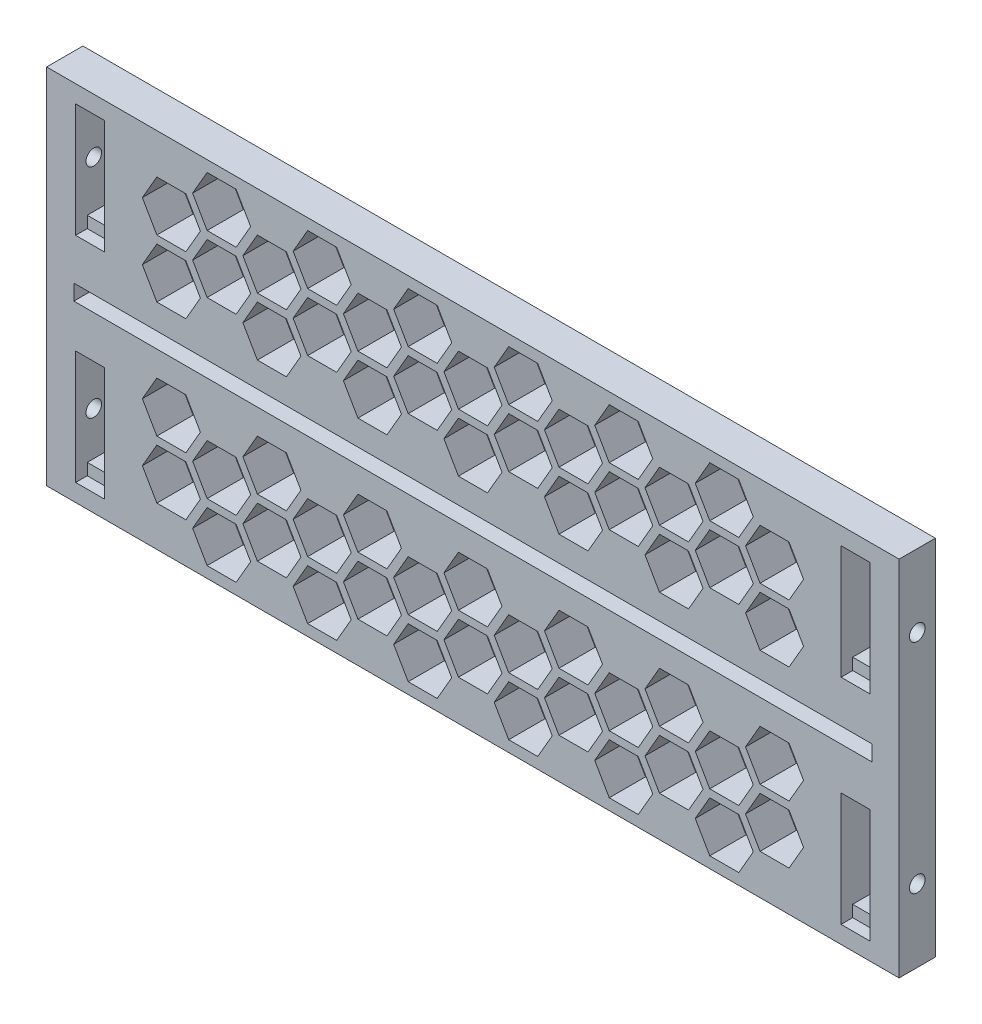
from build123d import *

# Parameters (mm, degrees)
SKETCH1_W                                  = 235
SKETCH1_H                                  = 100
BOSS_EXTRUDE1_DEPTH                        = 10
CUT_EXTRUDE1_REACH                         = 130.087
SKETCH3_W                                  = 8
SKETCH3_H                                  = 25
SKETCH4_R                                  = 2.15
CUT_EXTRUDE2_DEPTH                         = 8
SKETCH5_W                                  = 220
SKETCH5_H                                  = 4.3
CUT_EXTRUDE3_DEPTH                         = 10
FILL_PATTERN1_DEPTH                        = 10
SKETCH7_W                                  = 8
SKETCH7_H                                  = 3.2
CUT_EXTRUDE4_DEPTH                         = 3.2
MIRROR4_AT_THE_SECOND_PLANE_COPY_1_REACH   = 130.087
MIRROR4_AT_THE_SECOND_PLANE_COPY_1_SKETC_W = 8
MIRROR4_AT_THE_SECOND_PLANE_COPY_1_SKETC_H = 25
MIRROR4_AT_THE_SECOND_PLANE_COPY_2_SKETC_W = 8
MIRROR4_AT_THE_SECOND_PLANE_COPY_2_SKETC_H = 3.2
MIRROR4_AT_THE_SECOND_PLANE_COPY_2_DEPTH   = 3.2


# Read off the part's stored shape, not the designer's step: Fill Pattern1
with BuildPart() as part:
    # Sketch1 → Boss-Extrude1 (new body)
    with BuildSketch(Plane.XY):
        Rectangle(SKETCH1_W, SKETCH1_H)
    extrude(amount=BOSS_EXTRUDE1_DEPTH)

    # Sketch3 → Cut-Extrude1 (cut, up to next)
    with BuildSketch(Plane.XY.offset(10), mode=Mode.PRIVATE) as cut_extrude1_sk1:
        with Locations((-105.5, 29.5)):
            Rectangle(SKETCH3_W, SKETCH3_H)
    cut_extrude1_tool1 = extrude(cut_extrude1_sk1.sketch, amount=-CUT_EXTRUDE1_REACH, mode=Mode.PRIVATE) & part.part
    cut_extrude1 = cut_extrude1_tool1.solids().sort_by_distance((-105.5, 29.5, 10))[0]
    add(cut_extrude1, mode=Mode.SUBTRACT)

    # Sketch4 → Cut-Extrude2 (cut)
    with BuildSketch(Plane.ZY.offset(117.5)):
        with Locations(Location((5, -30, 0), (0, 0, 270))):
            Circle(SKETCH4_R)
        with Locations(Location((5, 30, 0), (0, 0, 270))):
            Circle(SKETCH4_R)
    cut_extrude2 = extrude(amount=-CUT_EXTRUDE2_DEPTH, mode=Mode.SUBTRACT)

    # Mirror1: Cut-Extrude2 across plane
    add(cut_extrude2.mirror(Plane.ZY), mode=Mode.SUBTRACT)

    # Sketch5 → Cut-Extrude3 (cut)
    with BuildSketch(Plane.XY.offset(10)):
        Rectangle(SKETCH5_W, SKETCH5_H)
    extrude(amount=-CUT_EXTRUDE3_DEPTH, mode=Mode.SUBTRACT)

    # Fill Pattern1 outline → Fill Pattern1 (cut)
    with BuildSketch(Plane.XY):
        Polygon((77.306824734, -40), (73.306824734, -33.07179677), (65.306824734, -33.07179677), (61.306824734, -40), (65.306824734, -46.92820323), (73.306824734, -46.92820323), align=None)
        Polygon((35.737605353, 32), (31.737605353, 38.92820323), (23.737605353, 38.92820323), (19.737605353, 32), (23.737605353, 25.07179677), (31.737605353, 25.07179677), align=None)
        Polygon((63.450418274, -16), (59.450418274, -9.07179677), (51.450418274, -9.07179677), (47.450418274, -16), (51.450418274, -22.92820323), (59.450418274, -22.92820323), align=None)
        Polygon((45.594011813, -33.07179677), (37.594011813, -33.07179677), (33.594011813, -40), (37.594011813, -46.92820323), (45.594011813, -46.92820323), (49.594011813, -40), align=None)
        Polygon((17.881198892, -33.07179677), (9.881198892, -33.07179677), (5.881198892, -40), (9.881198892, -46.92820323), (17.881198892, -46.92820323), (21.881198892, -40), align=None)
        Polygon((-9.831614029, -33.07179677), (-17.831614029, -33.07179677), (-21.831614029, -40), (-17.831614029, -46.92820323), (-9.831614029, -46.92820323), (-5.831614029, -40), align=None)
        Polygon((-37.54442695, -33.07179677), (-45.54442695, -33.07179677), (-49.54442695, -40), (-45.54442695, -46.92820323), (-37.54442695, -46.92820323), (-33.54442695, -40), align=None)
        Polygon((-65.257239871, -33.07179677), (-73.257239871, -33.07179677), (-77.257239871, -40), (-73.257239871, -46.92820323), (-65.257239871, -46.92820323), (-61.257239871, -40), align=None)
        Polygon((79.163231195, -9.07179677), (75.163231195, -16), (79.163231195, -22.92820323), (87.163231195, -22.92820323), (91.163231195, -16), (87.163231195, -9.07179677), align=None)
        Polygon((21.881198892, 40), (17.881198892, 46.92820323), (9.881198892, 46.92820323), (5.881198892, 40), (9.881198892, 33.07179677), (17.881198892, 33.07179677), align=None)
        Polygon((35.737605353, 16), (31.737605353, 22.92820323), (23.737605353, 22.92820323), (19.737605353, 16), (23.737605353, 9.07179677), (31.737605353, 9.07179677), align=None)
        Polygon((63.450418274, -32), (59.450418274, -25.07179677), (51.450418274, -25.07179677), (47.450418274, -32), (51.450418274, -38.92820323), (59.450418274, -38.92820323), align=None)
        Polygon((-37.54442695, 46.92820323), (-45.54442695, 46.92820323), (-49.54442695, 40), (-45.54442695, 33.07179677), (-37.54442695, 33.07179677), (-33.54442695, 40), align=None)
        Polygon((-9.831614029, 46.92820323), (-17.831614029, 46.92820323), (-21.831614029, 40), (-17.831614029, 33.07179677), (-9.831614029, 33.07179677), (-5.831614029, 40), align=None)
        Polygon((73.306824734, 46.92820323), (65.306824734, 46.92820323), (61.306824734, 40), (65.306824734, 33.07179677), (73.306824734, 33.07179677), (77.306824734, 40), align=None)
        Polygon((45.594011813, 46.92820323), (37.594011813, 46.92820323), (33.594011813, 40), (37.594011813, 33.07179677), (45.594011813, 33.07179677), (49.594011813, 40), align=None)
        Polygon((-65.257239871, 46.92820323), (-73.257239871, 46.92820323), (-77.257239871, 40), (-73.257239871, 33.07179677), (-65.257239871, 33.07179677), (-61.257239871, 40), align=None)
        Polygon((-3.975207568, 22.92820323), (-7.975207568, 16), (-3.975207568, 9.07179677), (4.024792432, 9.07179677), (8.024792432, 16), (4.024792432, 22.92820323), align=None)
        Polygon((-31.688020489, -25.07179677), (-35.688020489, -32), (-31.688020489, -38.92820323), (-23.688020489, -38.92820323), (-19.688020489, -32), (-23.688020489, -25.07179677), align=None)
        Polygon((21.881198892, 24), (17.881198892, 30.92820323), (9.881198892, 30.92820323), (5.881198892, 24), (9.881198892, 17.07179677), (17.881198892, 17.07179677), align=None)
        Polygon((49.594011813, -24), (45.594011813, -17.07179677), (37.594011813, -17.07179677), (33.594011813, -24), (37.594011813, -30.92820323), (45.594011813, -30.92820323), align=None)
        Polygon((45.594011813, 30.92820323), (37.594011813, 30.92820323), (33.594011813, 24), (37.594011813, 17.07179677), (45.594011813, 17.07179677), (49.594011813, 24), align=None)
        Polygon((73.306824734, 30.92820323), (65.306824734, 30.92820323), (61.306824734, 24), (65.306824734, 17.07179677), (73.306824734, 17.07179677), (77.306824734, 24), align=None)
        Polygon((-9.831614029, 30.92820323), (-17.831614029, 30.92820323), (-21.831614029, 24), (-17.831614029, 17.07179677), (-9.831614029, 17.07179677), (-5.831614029, 24), align=None)
        Polygon((-65.257239871, 30.92820323), (-73.257239871, 30.92820323), (-77.257239871, 24), (-73.257239871, 17.07179677), (-65.257239871, 17.07179677), (-61.257239871, 24), align=None)
        Polygon((-37.54442695, 30.92820323), (-45.54442695, 30.92820323), (-49.54442695, 24), (-45.54442695, 17.07179677), (-37.54442695, 17.07179677), (-33.54442695, 24), align=None)
        Polygon((-17.831614029, -17.07179677), (-21.831614029, -24), (-17.831614029, -30.92820323), (-9.831614029, -30.92820323), (-5.831614029, -24), (-9.831614029, -17.07179677), align=None)
        Polygon((59.450418274, 22.92820323), (51.450418274, 22.92820323), (47.450418274, 16), (51.450418274, 9.07179677), (59.450418274, 9.07179677), (63.450418274, 16), align=None)
        Polygon((87.163231195, 22.92820323), (79.163231195, 22.92820323), (75.163231195, 16), (79.163231195, 9.07179677), (87.163231195, 9.07179677), (91.163231195, 16), align=None)
        Polygon((-79.113646332, 22.92820323), (-87.113646332, 22.92820323), (-91.113646332, 16), (-87.113646332, 9.07179677), (-79.113646332, 9.07179677), (-75.113646332, 16), align=None)
        Polygon((-51.40083341, 22.92820323), (-59.40083341, 22.92820323), (-63.40083341, 16), (-59.40083341, 9.07179677), (-51.40083341, 9.07179677), (-47.40083341, 16), align=None)
        Polygon((-23.688020489, 22.92820323), (-31.688020489, 22.92820323), (-35.688020489, 16), (-31.688020489, 9.07179677), (-23.688020489, 9.07179677), (-19.688020489, 16), align=None)
        Polygon((-3.975207568, -25.07179677), (-7.975207568, -32), (-3.975207568, -38.92820323), (4.024792432, -38.92820323), (8.024792432, -32), (4.024792432, -25.07179677), align=None)
        Polygon((91.163231195, -32), (87.163231195, -25.07179677), (79.163231195, -25.07179677), (75.163231195, -32), (79.163231195, -38.92820323), (87.163231195, -38.92820323), align=None)
        Polygon((23.737605353, -25.07179677), (19.737605353, -32), (23.737605353, -38.92820323), (31.737605353, -38.92820323), (35.737605353, -32), (31.737605353, -25.07179677), align=None)
        Polygon((91.163231195, 32), (87.163231195, 38.92820323), (79.163231195, 38.92820323), (75.163231195, 32), (79.163231195, 25.07179677), (87.163231195, 25.07179677), align=None)
        Polygon((4.024792432, 38.92820323), (-3.975207568, 38.92820323), (-7.975207568, 32), (-3.975207568, 25.07179677), (4.024792432, 25.07179677), (8.024792432, 32), align=None)
        Polygon((59.450418274, 38.92820323), (51.450418274, 38.92820323), (47.450418274, 32), (51.450418274, 25.07179677), (59.450418274, 25.07179677), (63.450418274, 32), align=None)
        Polygon((-79.113646332, 38.92820323), (-87.113646332, 38.92820323), (-91.113646332, 32), (-87.113646332, 25.07179677), (-79.113646332, 25.07179677), (-75.113646332, 32), align=None)
        Polygon((-23.688020489, 38.92820323), (-31.688020489, 38.92820323), (-35.688020489, 32), (-31.688020489, 25.07179677), (-23.688020489, 25.07179677), (-19.688020489, 32), align=None)
        Polygon((-51.40083341, 38.92820323), (-59.40083341, 38.92820323), (-63.40083341, 32), (-59.40083341, 25.07179677), (-51.40083341, 25.07179677), (-47.40083341, 32), align=None)
        Polygon((-3.975207568, -9.07179677), (-7.975207568, -16), (-3.975207568, -22.92820323), (4.024792432, -22.92820323), (8.024792432, -16), (4.024792432, -9.07179677), align=None)
        Polygon((77.306824734, -24), (73.306824734, -17.07179677), (65.306824734, -17.07179677), (61.306824734, -24), (65.306824734, -30.92820323), (73.306824734, -30.92820323), align=None)
        Polygon((9.881198892, -17.07179677), (5.881198892, -24), (9.881198892, -30.92820323), (17.881198892, -30.92820323), (21.881198892, -24), (17.881198892, -17.07179677), align=None)
        Polygon((-19.688020489, -16), (-23.688020489, -9.07179677), (-31.688020489, -9.07179677), (-35.688020489, -16), (-31.688020489, -22.92820323), (-23.688020489, -22.92820323), align=None)
        Polygon((31.737605353, -9.07179677), (23.737605353, -9.07179677), (19.737605353, -16), (23.737605353, -22.92820323), (31.737605353, -22.92820323), (35.737605353, -16), align=None)
        Polygon((-79.113646332, -9.07179677), (-87.113646332, -9.07179677), (-91.113646332, -16), (-87.113646332, -22.92820323), (-79.113646332, -22.92820323), (-75.113646332, -16), align=None)
        Polygon((-51.40083341, -9.07179677), (-59.40083341, -9.07179677), (-63.40083341, -16), (-59.40083341, -22.92820323), (-51.40083341, -22.92820323), (-47.40083341, -16), align=None)
        Polygon((-87.113646332, -25.07179677), (-91.113646332, -32), (-87.113646332, -38.92820323), (-79.113646332, -38.92820323), (-75.113646332, -32), (-79.113646332, -25.07179677), align=None)
        Polygon((-59.40083341, -25.07179677), (-63.40083341, -32), (-59.40083341, -38.92820323), (-51.40083341, -38.92820323), (-47.40083341, -32), (-51.40083341, -25.07179677), align=None)
        Polygon((-45.54442695, -17.07179677), (-49.54442695, -24), (-45.54442695, -30.92820323), (-37.54442695, -30.92820323), (-33.54442695, -24), (-37.54442695, -17.07179677), align=None)
        Polygon((-65.257239871, -17.07179677), (-73.257239871, -17.07179677), (-77.257239871, -24), (-73.257239871, -30.92820323), (-65.257239871, -30.92820323), (-61.257239871, -24), align=None)
    extrude(amount=FILL_PATTERN1_DEPTH, mode=Mode.SUBTRACT)

    # Sketch7 → Cut-Extrude4 (cut)
    with BuildSketch(Plane.XY.offset(10)):
        with Locations((-105.5, 43.6)):
            Rectangle(SKETCH7_W, SKETCH7_H)
        with Locations((-105.5, 15.4)):
            Rectangle(SKETCH7_W, SKETCH7_H)
    cut_extrude4 = extrude(amount=-CUT_EXTRUDE4_DEPTH, mode=Mode.SUBTRACT)

    # Mirror4: Cut-Extrude1, Cut-Extrude4 across plane
    add(cut_extrude1.mirror(Plane.ZY), mode=Mode.SUBTRACT)
    add(cut_extrude4.mirror(Plane.ZY), mode=Mode.SUBTRACT)

    # Mirror4 at the second plane: Cut-Extrude1, Cut-Extrude4 across plane
    add(cut_extrude1.mirror(Plane.ZX), mode=Mode.SUBTRACT)
    add(cut_extrude4.mirror(Plane.ZX), mode=Mode.SUBTRACT)

    # Mirror4 at the second plane copy 1 sketc → Mirror4 at the second plane copy 1 (cut, up to next)
    with BuildSketch(Plane(origin=(0, 0, 10), x_dir=(-1, 0, 0), z_dir=(0, 0, 1)), mode=Mode.PRIVATE) as mirror4_at_the_second_plane_copy_1_sk1:
        with Locations((-105.5, 29.5)):
            Rectangle(MIRROR4_AT_THE_SECOND_PLANE_COPY_1_SKETC_W, MIRROR4_AT_THE_SECOND_PLANE_COPY_1_SKETC_H)
    mirror4_at_the_second_plane_copy_1_tool1 = extrude(mirror4_at_the_second_plane_copy_1_sk1.sketch, amount=-MIRROR4_AT_THE_SECOND_PLANE_COPY_1_REACH, mode=Mode.PRIVATE) & part.part
    add(mirror4_at_the_second_plane_copy_1_tool1.solids().sort_by_distance((105.5, -29.5, 10))[0], mode=Mode.SUBTRACT)

    # Mirror4 at the second plane copy 2 sketc → Mirror4 at the second plane copy 2 (cut)
    with BuildSketch(Plane(origin=(0, 0, 10), x_dir=(-1, 0, 0), z_dir=(0, 0, 1))):
        with Locations((-105.5, 43.6)):
            Rectangle(MIRROR4_AT_THE_SECOND_PLANE_COPY_2_SKETC_W, MIRROR4_AT_THE_SECOND_PLANE_COPY_2_SKETC_H)
        with Locations((-105.5, 15.4)):
            Rectangle(MIRROR4_AT_THE_SECOND_PLANE_COPY_2_SKETC_W, MIRROR4_AT_THE_SECOND_PLANE_COPY_2_SKETC_H)
    extrude(amount=-MIRROR4_AT_THE_SECOND_PLANE_COPY_2_DEPTH, mode=Mode.SUBTRACT)


solid = part.part
